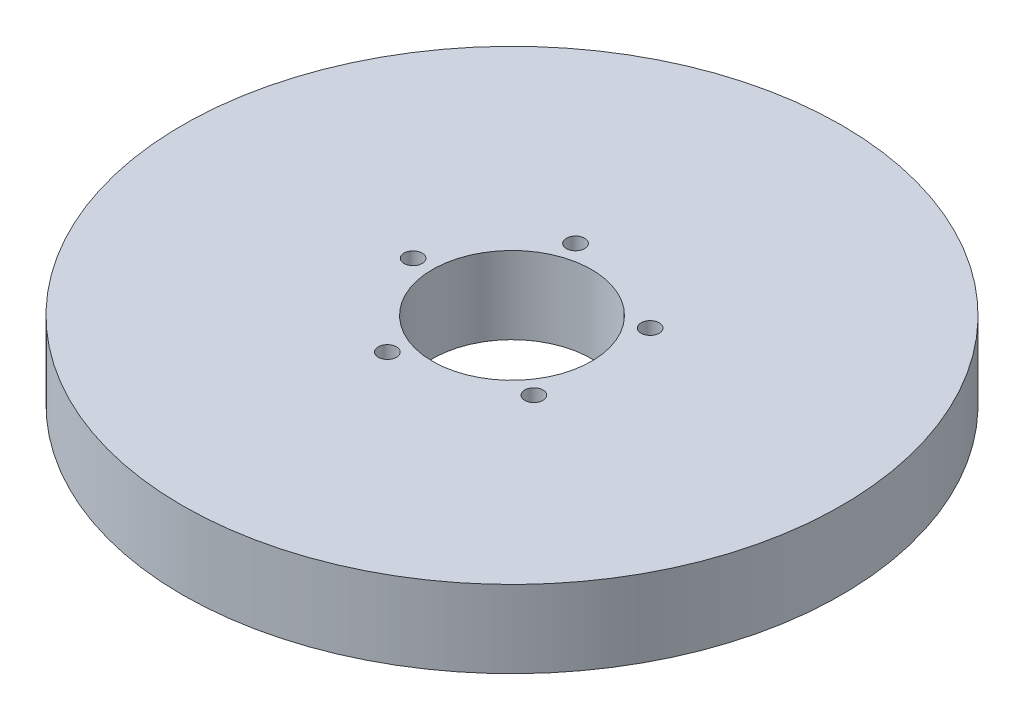
from build123d import *

# Parameters (mm, degrees)
SKETCH1_R           = 72.5
BOSS_EXTRUDE1_DEPTH = 17
SKETCH2_R           = 17.5
CUT_EXTRUDE1_DEPTH  = 104.930265082
SKETCH3_R           = 1.997827515
CUT_EXTRUDE2_DEPTH  = 12.147500007
CIRPATTERN1_COUNT   = 5


with BuildPart() as part:
    # Sketch1 → Boss-Extrude1 (new body)
    with BuildSketch(Plane(origin=(0, 0, 0), x_dir=(1, 0, 0), z_dir=(0, 1, 0))):
        Circle(SKETCH1_R)
    extrude(amount=BOSS_EXTRUDE1_DEPTH)

    # Sketch2 → Cut-Extrude1 (cut, through all)
    with BuildSketch(Plane(origin=(0, 0, 0), x_dir=(1, 0, 0), z_dir=(0, 1, 0))):
        Circle(SKETCH2_R)
    extrude(amount=CUT_EXTRUDE1_DEPTH, mode=Mode.SUBTRACT)

    # Sketch3 → Cut-Extrude2 (cut)
    with BuildSketch(Plane(origin=(0, 17, 0), x_dir=(1, 0, 0), z_dir=(0, 1, 0))):
        with Locations((-21.763164863, 0)):
            Circle(SKETCH3_R)
    cut_extrude2 = extrude(amount=-CUT_EXTRUDE2_DEPTH, mode=Mode.SUBTRACT)

    # CirPattern1: Cut-Extrude2 ×5 about axis
    cirpattern1_axis = Axis((0, 0, 0), (0, 1, 0))
    for i in range(1, CIRPATTERN1_COUNT):
        add(cut_extrude2.rotate(cirpattern1_axis, i * 360 / CIRPATTERN1_COUNT), mode=Mode.SUBTRACT)


solid = part.part
